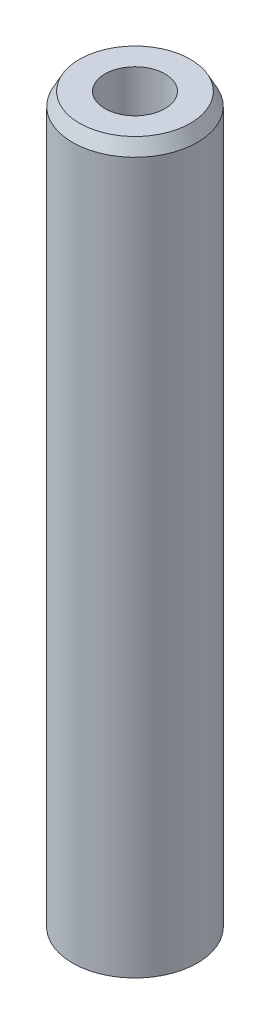
from build123d import *
from OCP.BRepFilletAPI import BRepFilletAPI_MakeChamfer

# Parameters (mm, degrees)
SKETCH1_R           = 17.5
BOSS_EXTRUDE1_DEPTH = 204.780357032
SKETCH2_R           = 8.429650739
CUT_EXTRUDE1_DEPTH  = 207.270440505
CHAMFER1_SIZE       = 3.658601576
CHAMFER1_SIZE2      = 1.964344724


with BuildPart() as part:
    # Sketch1 → Boss-Extrude1 (new body)
    with BuildSketch(Plane(origin=(0, 0, 0), x_dir=(1, 0, 0), z_dir=(0, 1, 0))):
        Circle(SKETCH1_R)
    extrude(amount=BOSS_EXTRUDE1_DEPTH)

    # Sketch2 → Cut-Extrude1 (cut, through all)
    with BuildSketch(Plane(origin=(0, 0, 0), x_dir=(1, 0, 0), z_dir=(0, 1, 0))):
        Circle(SKETCH2_R)
    extrude(amount=CUT_EXTRUDE1_DEPTH, mode=Mode.SUBTRACT)

    # Chamfer1: one chamfer whose edges measure the first distance from different faces: ONE call of the kernel's chamfer builder (chamfer() names one face for all edges)
    chamfer1_edges_1 = [part.edges().sort_by_distance(p)[0] for p in [
        (-17.5, 204.780357032, 0),
    ]]
    chamfer1_side_1 = [part.faces().sort_by_distance(p)[0] for p in [
        (-17.5, 102.390178516, 0),
    ]]
    chamfer1_edges_2 = [part.edges().sort_by_distance(p)[0] for p in [
        (-17.5, 0, 0),
    ]]
    chamfer1_side_2 = [part.faces().sort_by_distance(p)[0] for p in [
        (-17.005025253, 0, 0),
    ]]
    chamfer1 = BRepFilletAPI_MakeChamfer(part.part.solid().wrapped)
    for e in chamfer1_edges_1:
        chamfer1.Add(CHAMFER1_SIZE, CHAMFER1_SIZE2, e.wrapped, chamfer1_side_1[0].wrapped)  # the first distance lies on this face
    for e in chamfer1_edges_2:
        chamfer1.Add(CHAMFER1_SIZE, CHAMFER1_SIZE2, e.wrapped, chamfer1_side_2[0].wrapped)  # the first distance lies on this face
    add(Compound.cast(chamfer1.Shape()), mode=Mode.REPLACE)


solid = part.part
